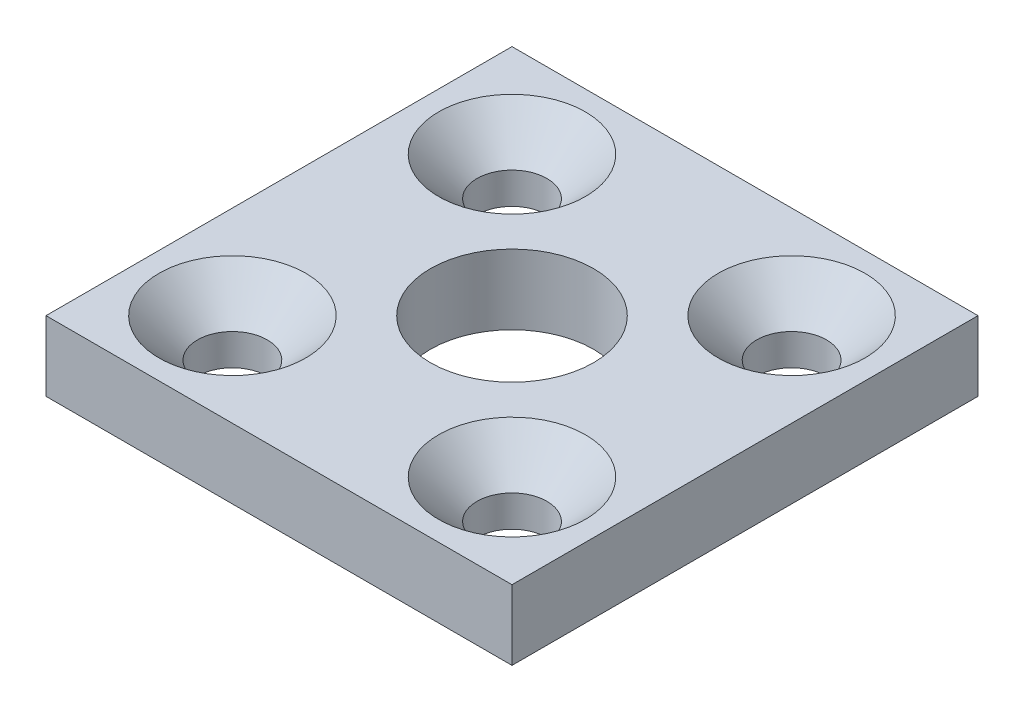
from build123d import *

# Parameters (mm, degrees)
SKETCH1_W           = 20
SKETCH1_H           = 20
SKETCH1_R           = 1.5
SKETCH1_R_2         = 3.5
BOSS_EXTRUDE1_DEPTH = 3
CHAMFER1_SIZE       = 1.65


with BuildPart() as part:
    # Sketch1 → Boss-Extrude1 (new body)
    with BuildSketch(Plane(origin=(0, 0, 0), x_dir=(1, 0, 0), z_dir=(0, 1, 0))):
        with Locations((10, 10)):
            Rectangle(SKETCH1_W, SKETCH1_H)
        with Locations((16, 16)):
            Circle(SKETCH1_R, mode=Mode.SUBTRACT)
        with Locations((4, 16)):
            Circle(SKETCH1_R, mode=Mode.SUBTRACT)
        with Locations((16, 4)):
            Circle(SKETCH1_R, mode=Mode.SUBTRACT)
        with Locations((4, 4)):
            Circle(SKETCH1_R, mode=Mode.SUBTRACT)
        with Locations((10, 10)):
            Circle(SKETCH1_R_2, mode=Mode.SUBTRACT)
    extrude(amount=BOSS_EXTRUDE1_DEPTH)

    # Chamfer1
    chamfer1_edges = [part.edges().sort_by_distance(p)[0] for p in [
        (14.5, 3, -4),
        (2.5, 3, -4),
        (2.5, 3, -16),
        (14.5, 3, -16),
    ]]
    chamfer(chamfer1_edges, length=CHAMFER1_SIZE)


solid = part.part
